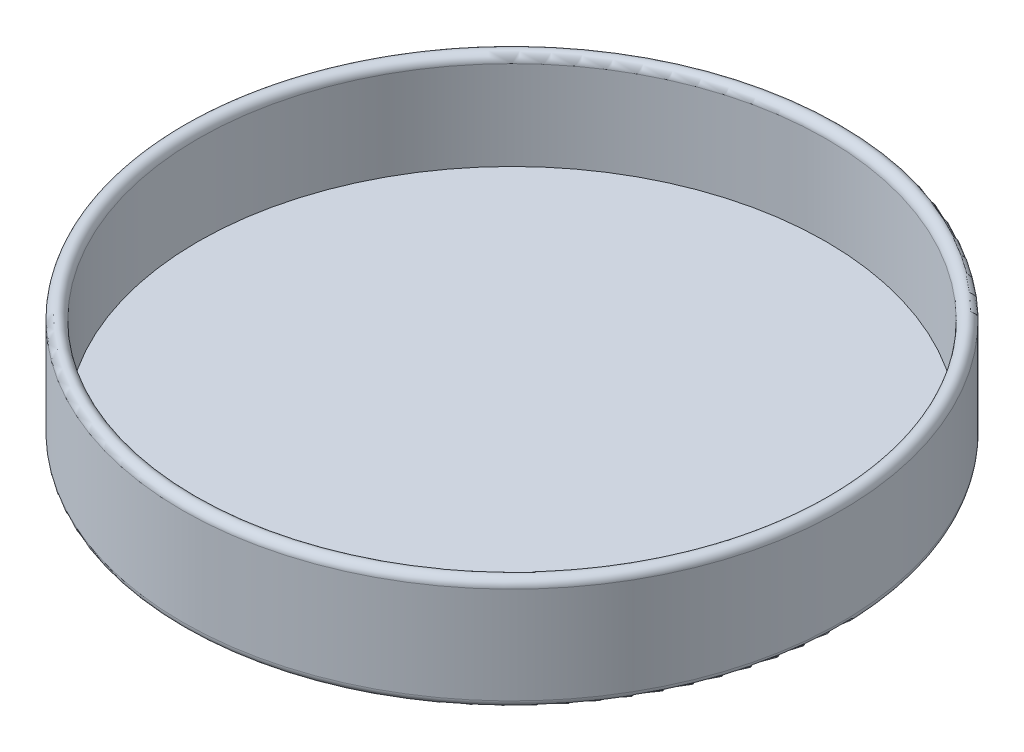
from build123d import *

# Parameters (mm, degrees)
SKETCH1_R           = 47
BOSS_EXTRUDE1_DEPTH = 16
SKETCH2_R           = 44.8
CUT_EXTRUDE1_DEPTH  = 13.8
FILLET1_R           = 1.1
FILLET2_R           = 1.1


with BuildPart() as part:
    # Sketch1 → Boss-Extrude1 (new body)
    with BuildSketch(Plane(origin=(0, 0, 0), x_dir=(1, 0, 0), z_dir=(0, 1, 0))):
        with Locations(Location((0, 0, 0), (0, 0, 270))):
            Circle(SKETCH1_R)
    extrude(amount=BOSS_EXTRUDE1_DEPTH)

    # Sketch2 → Cut-Extrude1 (cut)
    with BuildSketch(Plane(origin=(0, 16, 0), x_dir=(1, 0, 0), z_dir=(0, 1, 0))):
        with Locations(Location((0, 0, 0), (0, 0, 270))):
            Circle(SKETCH2_R)
    extrude(amount=-CUT_EXTRUDE1_DEPTH, mode=Mode.SUBTRACT)

    # Fillet1
    fillet1_edges = [part.edges().sort_by_distance(p)[0] for p in [
        (0, 16, -47),
        (0, 16, -44.8),
    ]]
    fillet(fillet1_edges, radius=FILLET1_R - 0.0001)  # a hair under: the kernel refuses the full size

    # Fillet2
    fillet2_edges = [part.edges().sort_by_distance(p)[0] for p in [
        (0, 0, -47),
    ]]
    fillet(fillet2_edges, radius=FILLET2_R)


solid = part.part
